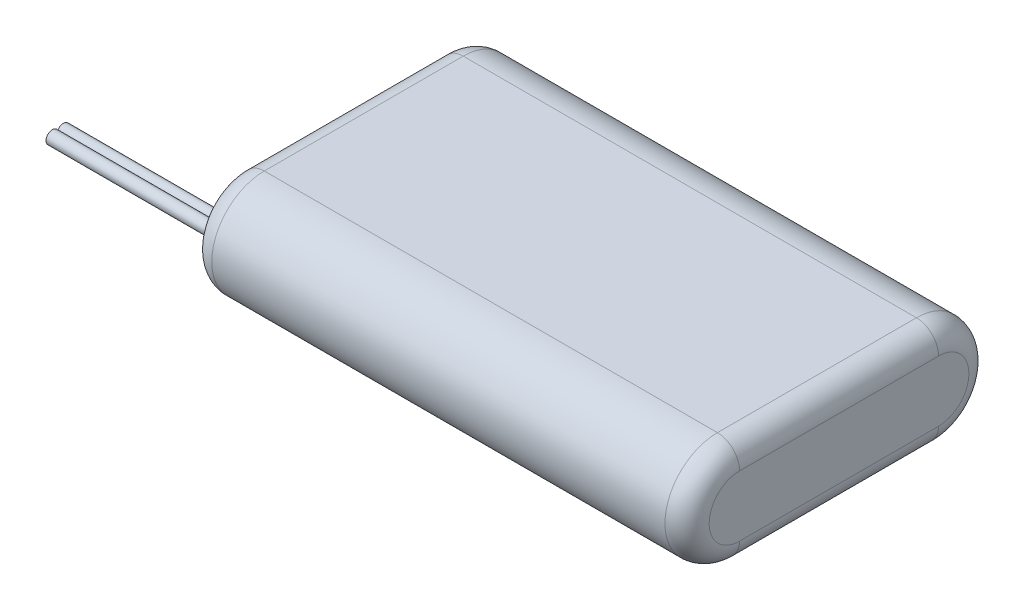
from build123d import *

# Parameters (mm, degrees)
BOSS_EXTRUDE1_DEPTH = 22.5
FILLET1_R           = 2
BOSS_EXTRUDE2_DEPTH = 15


with BuildPart() as part:
    # Sketch1 → Boss-Extrude1 (new, symmetric)
    with BuildSketch(Plane(origin=(0, 0, 0), x_dir=(0, 0, -1), z_dir=(1, 0, 0))):
        with BuildLine():
            Line((-9, 4.75), (9, 4.75))
            ThreePointArc((9, 4.75), (13.75, 0), (9, -4.75))
            Line((9, -4.75), (-9, -4.75))
            ThreePointArc((-9, -4.75), (-13.75, 0), (-9, 4.75))
        make_face()
    extrude(amount=BOSS_EXTRUDE1_DEPTH, both=True)

    # Fillet1
    fillet1_edges = [part.edges().sort_by_distance(p)[0] for p in [
        (-22.5, 0, 13.75),
        (-22.5, 4.75, 0),
        (-22.5, 0, -13.75),
        (22.5, 4.75, 0),
        (22.5, 0, -13.75),
        (22.5, -4.75, 0),
        (22.5, 0, 13.75),
        (-22.5, -4.75, 0),
    ]]
    fillet(fillet1_edges, radius=FILLET1_R)

    # Sketch2 → Boss-Extrude2 (add)
    with BuildSketch(Plane.ZY.offset(22.5)):
        with BuildLine():
            ThreePointArc((10.675, 0.283945417), (9.6, 0), (10.675, -0.283945417))
            ThreePointArc((10.675, -0.283945417), (11.75, 0), (10.675, 0.283945417))
        make_face()
    extrude(amount=BOSS_EXTRUDE2_DEPTH)


solid = part.part
